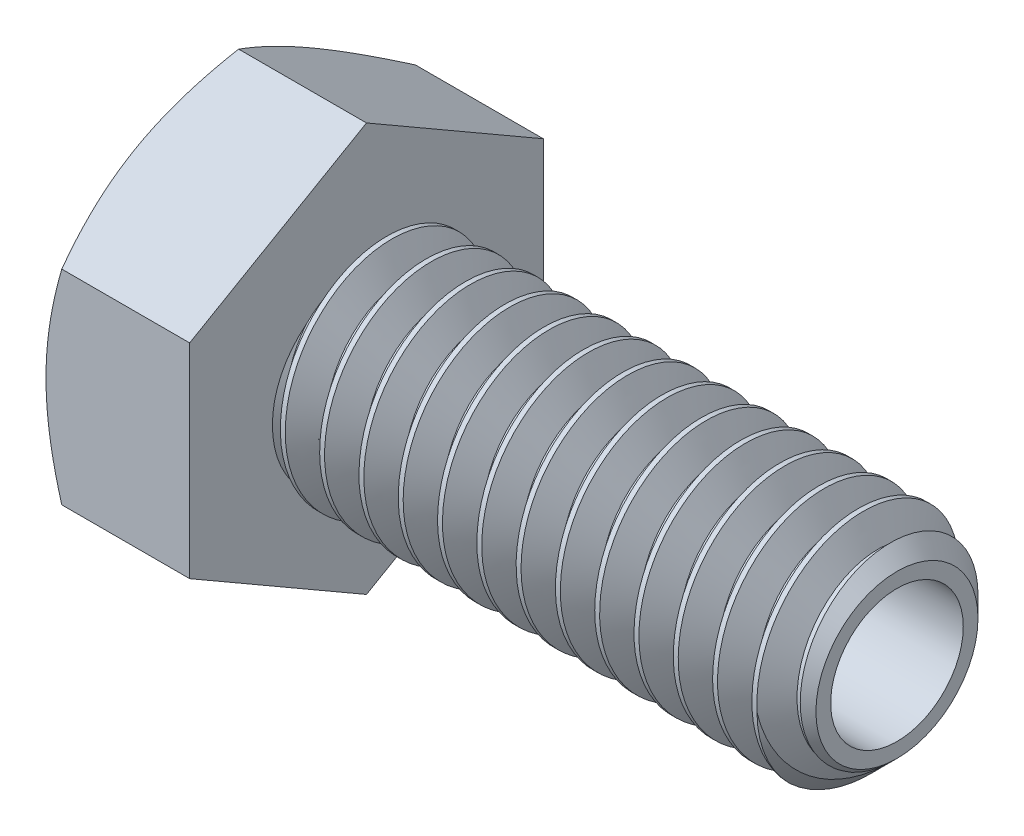
from build123d import *

# Parameters (mm, degrees)
SKETCH5_R           = 3.96875
BOSS_EXTRUDE3_DEPTH = 19.05
CHAMFER1_SIZE       = 1.058333333
CUT_SWEEP1_PITCH    = 1.411111111
BOSS_EXTRUDE4_DEPTH = 5.159375
SKETCH8_OUTSIDE_W   = 114.714
SKETCH8_OUTSIDE_H   = 116.678
SKETCH8_OUTSIDE_R   = 6.35
CUT_EXTRUDE3_DEPTH  = 27.080254577
CUT_EXTRUDE3_DRAFT  = -60
SKETCH11_R          = 2.38125
CUT_EXTRUDE4_DEPTH  = 21.034375


with BuildPart() as part:
    # Sketch5 → Boss-Extrude3 (new body)
    with BuildSketch(Plane(origin=(12.1046875, 0, 0), x_dir=(0, 0, -1), z_dir=(1, 0, 0))):
        Circle(SKETCH5_R)
    extrude(amount=-BOSS_EXTRUDE3_DEPTH)

    # Chamfer1
    chamfer1_edges = [part.edges().sort_by_distance(p)[0] for p in [
        (12.1046875, 0, 3.96875),
    ]]
    chamfer(chamfer1_edges, length=CHAMFER1_SIZE)

    # Cut-Sweep1: the profile of Sketch10 profile screwed along a right-hand helix of 14.5 turns, 8 arcs to a turn; built about Z, then put on its axis
    cut_sweep1_z = Axis((0, 0, 0), (0, 0, 1))
    cut_sweep1_corners = [(3.96905, 0, 0.000173205), (3.052206448, 0, -0.529166667), (3.052206448, 0, -0.705555556), (3.96905, 0, -1.234895427)]
    with BuildLine(mode=Mode.PRIVATE) as cut_sweep1_profile:
        Line(cut_sweep1_corners[0], cut_sweep1_corners[1])
        Line(cut_sweep1_corners[1], cut_sweep1_corners[2])
        Line(cut_sweep1_corners[2], cut_sweep1_corners[3])
        Line(cut_sweep1_corners[3], cut_sweep1_corners[0])
    cut_sweep1_cap = Face(cut_sweep1_profile.wire())
    cut_sweep1_turn_angles = [0, 22.5, 45, 67.5, 90, 112.5, 135, 157.5, 180, 202.5, 225, 247.5, 270, 292.5, 315, 337.5, 360]
    cut_sweep1_turn_weights = [1, 0.9238795325112867, 1, 0.9238795325112867, 1, 0.9238795325112867, 1, 0.9238795325112867, 1, 0.9238795325112867, 1, 0.9238795325112867, 1, 0.9238795325112867, 1, 0.9238795325112867, 1]
    cut_sweep1_turn_rails = [Edge.make_bspline([Vector(p[0], p[1], 0).rotate(cut_sweep1_z, cut_sweep1_turn_angles[k]) / cut_sweep1_turn_weights[k] + Vector(0, 0, p[2] + CUT_SWEEP1_PITCH * cut_sweep1_turn_angles[k] / 360) for k in range(17)], [0, 0, 0, 1, 1, 2, 2, 3, 3, 4, 4, 5, 5, 6, 6, 7, 7, 8, 8, 8], 2, cut_sweep1_turn_weights) for p in cut_sweep1_corners]
    cut_sweep1_turn_sides = [Face.make_surface_from_curves(cut_sweep1_turn_rails[p[0]], cut_sweep1_turn_rails[p[1]]) for p in [(0, 1), (1, 2), (2, 3), (3, 0)]]
    cut_sweep1_last_angles = [5040, 5062.5, 5085, 5107.5, 5130, 5152.5, 5175, 5197.5, 5220]
    cut_sweep1_last_weights = [1, 0.9238795325112867, 1, 0.9238795325112867, 1, 0.9238795325112867, 1, 0.9238795325113293, 1]
    cut_sweep1_last_rails = [Edge.make_bspline([Vector(p[0], p[1], 0).rotate(cut_sweep1_z, cut_sweep1_last_angles[k]) / cut_sweep1_last_weights[k] + Vector(0, 0, p[2] + CUT_SWEEP1_PITCH * cut_sweep1_last_angles[k] / 360) for k in range(9)], [0, 0, 0, 1, 1, 2, 2, 3, 3, 4, 4, 4], 2, cut_sweep1_last_weights) for p in cut_sweep1_corners]
    cut_sweep1_last_sides = [Face.make_surface_from_curves(cut_sweep1_last_rails[p[0]], cut_sweep1_last_rails[p[1]]) for p in [(0, 1), (1, 2), (2, 3), (3, 0)]]
    cut_sweep1 = Plane(origin=(12.1046875, 0, 0), x_dir=(0, 1, 0), z_dir=(-1, 0, 0)) * Solid(Shell([*[p.moved(Location((0, 0, CUT_SWEEP1_PITCH * i))) for i in range(14) for p in cut_sweep1_turn_sides], *cut_sweep1_last_sides, cut_sweep1_cap, cut_sweep1_cap.rotate(cut_sweep1_z, 5220).moved(Location((0, 0, CUT_SWEEP1_PITCH * 5220 / 360)))]))
    add(cut_sweep1, mode=Mode.SUBTRACT)

    # Sketch6 → Boss-Extrude4 (add)
    with BuildSketch(Plane.ZY.offset(6.9453125)):
        Polygon((6.35, 3.666174209), (0, 7.332348419), (-6.35, 3.666174209), (-6.35, -3.666174209), (0, -7.332348419), (6.35, -3.666174209), align=None)
    extrude(amount=BOSS_EXTRUDE4_DEPTH)


with BuildPart() as cut_extrude3_tool:
    # Sketch8 outside → Cut-Extrude3 (with draft: the straight prism first)
    with BuildSketch(Plane.ZY.offset(12.1046875)):
        Rectangle(SKETCH8_OUTSIDE_W, SKETCH8_OUTSIDE_H)
        Circle(SKETCH8_OUTSIDE_R, mode=Mode.SUBTRACT)
    extrude(amount=-CUT_EXTRUDE3_DEPTH)
    # Cut-Extrude3: the draft: its side faces are tilted about the plane it starts from
    cut_extrude3_sides = [cut_extrude3_tool.faces().sort_by_distance(p)[0] for p in [
        (1.435439789, -58.339, 0),
        (1.435439789, 0, 57.357),
        (1.435439789, 58.339, 0),
        (1.435439789, 0, -57.357),
        (1.435439789, 0, -6.35),
    ]]
    draft(cut_extrude3_sides, Plane.ZY.offset(12.1046875), CUT_EXTRUDE3_DRAFT)


with BuildPart() as part_1:
    add(part.part)

    # Cut-Extrude3: cut by cut_extrude3_tool
    add(cut_extrude3_tool.part, mode=Mode.SUBTRACT)

    # Sketch11 → Cut-Extrude4 (cut)
    with BuildSketch(Plane(origin=(12.1046875, 0, 0), x_dir=(0, 0, -1), z_dir=(1, 0, 0))):
        Circle(SKETCH11_R)
    extrude(amount=-CUT_EXTRUDE4_DEPTH, mode=Mode.SUBTRACT)


solid = part_1.part
